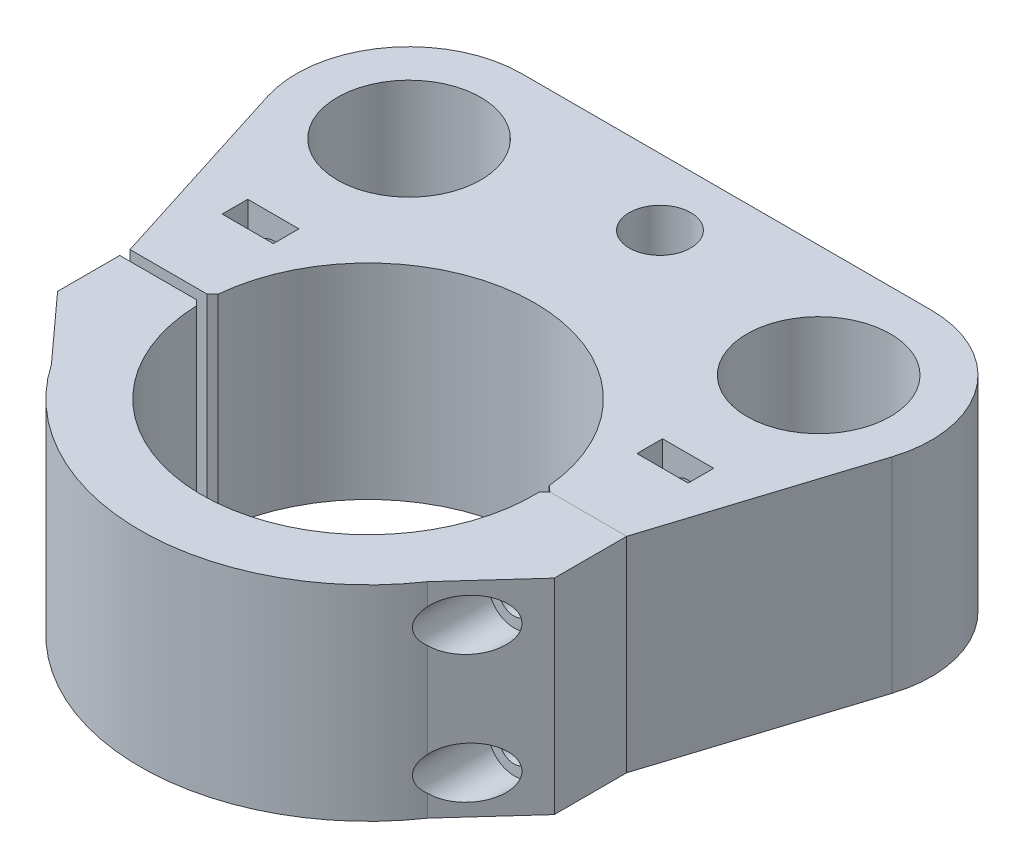
from build123d import *

# Parameters (mm, degrees)
SKETCH1_R               = 14
SKETCH1_R_2             = 6
BOSS_EXTRUDE1_DEPTH     = 40
BOSS_EXTRUDE2_DEPTH     = 40
SKETCH2_R               = 5
SKETCH2_R_2             = 3
CUT_EXTRUDE1_DEPTH      = 78.1
CUT_EXTRUDE2_DEPTH      = 111.308657901
CUT_EXTRUDE2_DEPTH_BACK = 35
SKETCH2_3_R             = 3
CUT_EXTRUDE3_DEPTH      = 5
CHAMFER2_SIZE           = 1
CHAMFER2_SIZE_2         = 1.067730124
CHAMFER3_SIZE           = 1


with BuildPart() as part:
    # Sketch1 → Boss-Extrude1 (new body)
    with BuildSketch(Plane(origin=(0, 0, 0), x_dir=(1, 0, 0), z_dir=(0, 1, 0))):
        with BuildLine():
            Line((-40, 70), (40, 70))
            ThreePointArc((40, 70), (57.751374155, 60.995719126), (60.97198842, 41.353519599))
            Line((60.97198842, 41.353519599), (48.5, 2))
            Line((48.5, 2), (32.438403167, 2))
            ThreePointArc((32.438403167, 2), (0, 32.5), (-32.438403167, 2))
            Line((-32.438403167, 2), (-48.5, 2))
            Line((-48.5, 2), (-60.97198842, 41.353519599))
            ThreePointArc((-60.97198842, 41.353519599), (-57.751374155, 60.995719126), (-40, 70))
        make_face()
        with Locations(Location((40, 48, 0), (0, 0, 270))):
            Circle(SKETCH1_R, mode=Mode.SUBTRACT)
        with Locations(Location((-40, 48, 0), (0, 0, 270))):
            Circle(SKETCH1_R, mode=Mode.SUBTRACT)
        with Locations(Location((0, 57, 0), (0, 0, 270))):
            Circle(SKETCH1_R_2, mode=Mode.SUBTRACT)
    extrude(amount=BOSS_EXTRUDE1_DEPTH)


with BuildPart() as body_2:
    # Sketch1<3> → Boss-Extrude2 (new, through all)
    with BuildSketch(Plane(origin=(0, 0, 0), x_dir=(1, 0, 0), z_dir=(0, 1, 0))):
        with BuildLine():
            Line((48.5, 2), (32.438403167, 2))
            ThreePointArc((32.438403167, 2), (1.000474159, -32.484597142), (-32.5, 0))
            Line((-32.5, 0), (-48.5, 0))
            Line((-48.5, 0), (-48.5, -12))
            Line((-48.5, -12), (-42.851487722, -12))
            ThreePointArc((-42.851487722, -12), (0, -44.5), (42.851487722, -12))
            Line((42.851487722, -12), (48.5, -12))
            Line((48.5, -12), (48.5, 2))
        make_face()
    extrude(amount=BOSS_EXTRUDE2_DEPTH)

    # Chamfer1
    # the kernel refuses this chamfer: 18, 9 mm, written as the material it adds along each edge
    with BuildSketch(Plane(origin=(-42.851487722, 0, 12), x_dir=(-1, 0, 0), z_dir=(0, 1, 0))) as chamfer1_piece_1_section:
        with BuildLine():
            Line((6.259138875, -0.533312536), (-6.588525819, 13.631757182))
            Line((-6.588525819, 13.631757182), (-6.885802285, 13.428713585))
            ThreePointArc((-6.885802285, 13.428713585), (-2.991055083, 6.960103108), (-0.346663721, -0.097078652))
            Line((-0.346663721, -0.097078652), (0, -0.36))
            ThreePointArc((0, -0.36), (3.129569437, -0.36), (6.259138875, -0.893312536))
            Line((6.259138875, -0.893312536), (6.259138875, -0.533312536))
        make_face()
    chamfer1_piece_1 = extrude(amount=40, mode=Mode.PRIVATE)
    chamfer1_piece_1 = split(chamfer1_piece_1, bisect_by=Plane(origin=(-48.5, 0, 12), z_dir=(1, 0, 0)), keep=Keep.TOP, mode=Mode.PRIVATE)
    add(chamfer1_piece_1)
    with BuildSketch(Plane(origin=(42.851487722, 0, 12), x_dir=(1, 0, 0), z_dir=(0, 1, 0))) as chamfer1_piece_2_section:
        with BuildLine():
            Line((6.259138875, 0.533312536), (-6.588525819, -13.631757182))
            Line((-6.588525819, -13.631757182), (-6.885802285, -13.428713585))
            ThreePointArc((-6.885802285, -13.428713585), (-2.991055083, -6.960103108), (-0.346663721, 0.097078652))
            Line((-0.346663721, 0.097078652), (0, 0.36))
            ThreePointArc((0, 0.36), (3.129569437, 0.36), (6.259138875, 0.893312536))
            Line((6.259138875, 0.893312536), (6.259138875, 0.533312536))
        make_face()
    chamfer1_piece_2 = extrude(amount=40, mode=Mode.PRIVATE)
    chamfer1_piece_2 = split(chamfer1_piece_2, bisect_by=Plane(origin=(48.5, 0, 12), z_dir=(-1, 0, 0)), keep=Keep.TOP, mode=Mode.PRIVATE)
    add(chamfer1_piece_2)

    # Sketch2 → Cut-Extrude1 (cut)
    # profile 1 of 4: a face of its own
    with BuildSketch(Plane.XY.offset(12)):
        with Locations(Location((-40.5, 32.5, 0), (0, 0, 180))):
            Circle(SKETCH2_R)
        with Locations(Location((-40.5, 32.5, 0), (0, 0, 180))):
            Circle(SKETCH2_R_2, mode=Mode.SUBTRACT)
    # profile 2 of 4: a face of its own
    with BuildSketch(Plane.XY.offset(12)):
        with Locations(Location((-40.5, 7.5, 0), (0, 0, 180))):
            Circle(SKETCH2_R)
        with Locations(Location((-40.5, 7.5, 0), (0, 0, 180))):
            Circle(SKETCH2_R_2, mode=Mode.SUBTRACT)
    # profile 3 of 4: a face of its own
    with BuildSketch(Plane.XY.offset(12)):
        with Locations(Location((40.5, 7.5, 0), (0, 0, 180))):
            Circle(SKETCH2_R)
        with Locations(Location((40.5, 7.5, 0), (0, 0, 180))):
            Circle(SKETCH2_R_2, mode=Mode.SUBTRACT)
    # profile 4 of 4: a face of its own
    with BuildSketch(Plane.XY.offset(12)):
        with Locations(Location((40.5, 32.5, 0), (0, 0, 180))):
            Circle(SKETCH2_R)
    extrude(amount=CUT_EXTRUDE1_DEPTH, mode=Mode.SUBTRACT)


with BuildPart() as cut_extrude2_tool:
    # Sketch2<3> → Cut-Extrude2 (new, two sides: drawn at the far end of the back side and taken through both)
    with BuildSketch(Plane.XY.offset(12).offset(-CUT_EXTRUDE2_DEPTH_BACK)):
        with Locations(Location((40.5, 7.5, 0), (0, 0, 180))):
            Circle(SKETCH2_3_R)
        with Locations(Location((-40.5, 32.5, 0), (0, 0, 180))):
            Circle(SKETCH2_3_R)
        with Locations(Location((-40.5, 7.5, 0), (0, 0, 180))):
            Circle(SKETCH2_3_R)
        with Locations(Location((40.5, 32.5, 0), (0, 0, 180))):
            Circle(SKETCH2_3_R)
    extrude(amount=CUT_EXTRUDE2_DEPTH + CUT_EXTRUDE2_DEPTH_BACK)


with BuildPart() as part_1:
    add(part.part)

    # Cut-Extrude2: cut by cut_extrude2_tool
    add(cut_extrude2_tool.part, mode=Mode.SUBTRACT)

    # Sketch3 → Cut-Extrude3 (cut)
    with BuildSketch(Plane.XY.offset(-17)):
        Polygon((-45.5, 37.5), (-45.5, 55.055829491), (-35.5, 55.055829491), (-35.5, 37.5), (-35.5, 27.5), (-45.5, 27.5), align=None)
        Polygon((-45.5, 2.5), (-45.5, 12.5), (-35.5, 12.5), (-35.5, 2.5), (-35.5, -15.733667286), (-45.5, -15.733667286), align=None)
        Polygon((35.5, -15.733667286), (35.5, 2.5), (35.5, 12.5), (45.5, 12.5), (45.5, 2.5), (45.5, -15.733667286), align=None)
        Polygon((35.5, 55.055829491), (35.5, 37.5), (35.5, 27.5), (45.5, 27.5), (45.5, 37.5), (45.5, 55.055829491), align=None)
    extrude(amount=-CUT_EXTRUDE3_DEPTH, mode=Mode.SUBTRACT)

    # Chamfer2
    # the kernel refuses this chamfer: 1.067730124, 1 mm, written as the material it takes off along each edge
    with BuildSketch(Plane(origin=(-32.438403167, -2.803300673, -2), x_dir=(-1, 0, 0), z_dir=(0, 1, 0))) as chamfer2_piece_1:
        with BuildLine():
            Line((CHAMFER2_SIZE, 0), (-0.085169492, -1.085169492))
            ThreePointArc((-0.085169492, -1.085169492), (-0.039316375, -0.559135608), (0, 0))
            Line((0, 0), (CHAMFER2_SIZE, 0))
        make_face()
    extrude(amount=45.606601345, mode=Mode.SUBTRACT)
    with BuildSketch(Plane(origin=(32.438403167, -2.75023745, -2), x_dir=(1, 0, 0), z_dir=(0, 1, 0))) as chamfer2_piece_2:
        with BuildLine():
            Line((CHAMFER2_SIZE_2, 0), (-0.078366679, 1.012978342))
            ThreePointArc((-0.078366679, 1.012978342), (-0.036411724, 0.52209249), (0, 0))
            Line((0, 0), (CHAMFER2_SIZE_2, 0))
        make_face()
    extrude(amount=45.5004749, mode=Mode.SUBTRACT)


with BuildPart() as body_2_1:
    add(body_2.part)

    # Cut-Extrude2: cut by cut_extrude2_tool
    add(cut_extrude2_tool.part, mode=Mode.SUBTRACT)

    # Chamfer3
    # the kernel refuses this chamfer: 1, 0.943713907 mm, written as the material it takes off along each edge
    with BuildSketch(Plane(origin=(-32.5, -2.612747277, 0), x_dir=(-1, 0, 0), z_dir=(0, 1, 0))) as chamfer3_piece_1:
        with BuildLine():
            Line((CHAMFER3_SIZE, 0), (-0.015881022, 1.015881022))
            ThreePointArc((-0.015881022, 1.015881022), (-0.00419828, 0.522370138), (0, 0))
            Line((0, 0), (CHAMFER3_SIZE, 0))
        make_face()
    extrude(amount=45.225494555, mode=Mode.SUBTRACT)
    with BuildSketch(Plane(origin=(32.438403167, -2.571682988, -2), x_dir=(0.046848125070118624, 0, 0.9989020238128535), z_dir=(0, 1, 0))) as chamfer3_piece_2:
        with BuildLine():
            Line((0.956251358, 0), (CHAMFER3_SIZE * 0.0468481250701, CHAMFER3_SIZE * 0.998902023813))
            Line((CHAMFER3_SIZE * 0.0468481250701, CHAMFER3_SIZE * 0.998902023813), (0, 0))
            ThreePointArc((0, 0), (0.491597341, 0.003514385), (0.956251358, 0))
        make_face()
    extrude(amount=45.143365976, mode=Mode.SUBTRACT)


solid = Compound([part_1.part, body_2_1.part])
